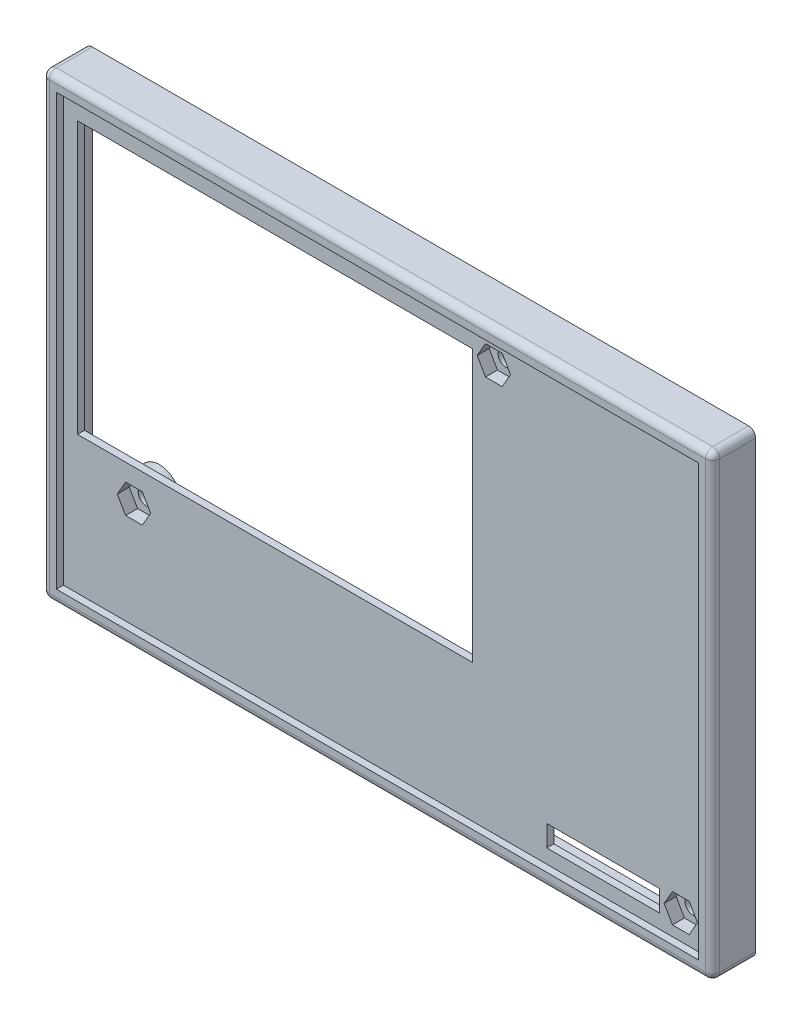
from build123d import *

# Parameters (mm, degrees)
EXTRUDE_346_DEPTH           = 5
EXTRUDE_346_DEPTH_BACK      = 1.1
SKETCH_2_W                  = 95
SKETCH_2_H                  = 65
SKETCH_3_W                  = 56
SKETCH_3_H                  = 38.5
CUT_EXTRUDE_448_DEPTH       = 5
CUT_EXTRUDE_527_DEPTH       = 3
CUT_EXTRUDE_527_DEPTH_BACK  = 1.1
SKETCH_4_W                  = 93
SKETCH_4_H                  = 63
CUT_EXTRUDE_START           = 5
SKETCH_5_W                  = 91
SKETCH_5_H                  = 61
CUT_EXTRUDE_612_DEPTH       = 1
CUT_EXTRUDE_START_2         = 4
SKETCH_6_W                  = 16
SKETCH_6_H                  = 3
CUT_EXTRUDE_697_DEPTH       = 1
WRAP_1_OUTLINE_R            = 3
WRAP_1_DEPTH                = 2.6
SKETCH_13_R                 = 1.1
CUT_EXTRUDE_1_DEPTH         = 116.221569161
SKETCH_15_R                 = 3
EXTRUDE_2_DEPTH             = 2.6
OTHER_START                 = 0.4
OTHER_2_OUTLINE_R           = 1.1
OTHER_2_DEPTH               = 3.6
SKETCH_16_R                 = 3
EXTRUDE_3_DEPTH             = 2.6
OTHER_3_OUTLINE_R           = 1.1
OTHER_3_DEPTH               = 3.6
EXTRUDE_1_DEPTH             = 4.1
EXTRUDE_2_2_DEPTH           = 4.1
EXTRUDE_3_2_DEPTH           = 4.1
EXTRUDE_4_DEPTH             = 4.1
CUT_EXTRUDE_3053_DEPTH      = 0.4
CUT_EXTRUDE_3053_DEPTH_BACK = 1.1
SKETCH_21_W                 = 91.4
SKETCH_21_H                 = 61.4
CUT_EXTRUDE_1_2_DEPTH       = 1.7
CUT_EXTRUDE_2_DEPTH         = 1.7
CUT_EXTRUDE_3_DEPTH         = 1.7
FILLET_1_R                  = 1
FILLET_2_R                  = 1
FILLET_3_R                  = 1
FILLET_4_R                  = 1


# Read off the part's stored shape, not the designer's step: Стойка1, Отверстие2, Отверстие3
with BuildPart() as part:
    # Эскиз2 → Extrude 346 (new, two sides: drawn at the far end of the back side and taken through both)
    with BuildSketch(Plane.XY.offset(-EXTRUDE_346_DEPTH_BACK)):
        with Locations((47.5, 32.5)):
            Rectangle(SKETCH_2_W, SKETCH_2_H)
    extrude(amount=EXTRUDE_346_DEPTH + EXTRUDE_346_DEPTH_BACK)

    # Эскиз3 → Cut-Extrude 448 (cut)
    with BuildSketch(Plane.XY):
        with Locations((32, 40.75)):
            Rectangle(SKETCH_3_W, SKETCH_3_H)
    extrude(amount=CUT_EXTRUDE_448_DEPTH, mode=Mode.SUBTRACT)

    # Эскиз4 → Cut-Extrude 527 (cut, two sides: drawn at the far end of the back side and taken through both)
    with BuildSketch(Plane.XY.offset(-CUT_EXTRUDE_527_DEPTH_BACK)):
        with Locations((47.5, 32.5)):
            Rectangle(SKETCH_4_W, SKETCH_4_H)
    extrude(amount=CUT_EXTRUDE_527_DEPTH + CUT_EXTRUDE_527_DEPTH_BACK, mode=Mode.SUBTRACT)

    # Эскиз5 → Cut-Extrude 612 (cut)
    with BuildSketch(Plane.XY.offset(CUT_EXTRUDE_START)):
        with Locations((47.5, 32.5)):
            Rectangle(SKETCH_5_W, SKETCH_5_H)
    extrude(amount=-CUT_EXTRUDE_612_DEPTH, mode=Mode.SUBTRACT)

    # Эскиз6 → Cut-Extrude 697 (cut)
    with BuildSketch(Plane.XY.offset(CUT_EXTRUDE_START_2)):
        with Locations((78.5, 5.5)):
            Rectangle(SKETCH_6_W, SKETCH_6_H)
    extrude(amount=-CUT_EXTRUDE_697_DEPTH, mode=Mode.SUBTRACT)

    # Стойка1 outline → Стойка1 (add)
    with BuildSketch(Plane(origin=(0, 0, 3), x_dir=(-1, 0, 0), z_dir=(0, 0, -1))):
        with Locations((-12, 17)):
            Circle(WRAP_1_OUTLINE_R)
    extrude(amount=WRAP_1_DEPTH)

    # Эскиз13 → Cut-Extrude 1 (cut, through all)
    with BuildSketch(Plane.XY.offset(4)):
        with Locations((12, 17)):
            Circle(SKETCH_13_R)
    extrude(amount=-CUT_EXTRUDE_1_DEPTH, mode=Mode.SUBTRACT)

    # Эскиз15 → Extrude 2 (add)
    with BuildSketch(Plane(origin=(0, 0, 3), x_dir=(-1, 0, 0), z_dir=(0, 0, -1))):
        with Locations((-63, 59.5)):
            Circle(SKETCH_15_R)
    extrude(amount=EXTRUDE_2_DEPTH)

    # Отверстие2 outline → Отверстие2 (cut)
    with BuildSketch(Plane.XY.offset(OTHER_START)):
        with Locations((63, 59.5)):
            Circle(OTHER_2_OUTLINE_R)
    extrude(amount=OTHER_2_DEPTH, mode=Mode.SUBTRACT)

    # Эскиз16 → Extrude 3 (add)
    with BuildSketch(Plane(origin=(0, 0, 3), x_dir=(-1, 0, 0), z_dir=(0, 0, -1))):
        with Locations((-89.5, 5.5)):
            Circle(SKETCH_16_R)
    extrude(amount=EXTRUDE_3_DEPTH)

    # Отверстие3 outline → Отверстие3 (cut)
    with BuildSketch(Plane.XY.offset(OTHER_START)):
        with Locations((89.5, 5.5)):
            Circle(OTHER_3_OUTLINE_R)
    extrude(amount=OTHER_3_DEPTH, mode=Mode.SUBTRACT)

    # Эскиз22 → Угол1 (add)
    with BuildSketch(Plane(origin=(0, 0, 3), x_dir=(-1, 0, 0), z_dir=(0, 0, -1))):
        Polygon((-1, 64), (-1, 60), (-5, 64), align=None)
    extrude(amount=EXTRUDE_1_DEPTH)

    # Эскиз20 → Extrude 2 2 (add)
    with BuildSketch(Plane(origin=(0, 0, 3), x_dir=(-1, 0, 0), z_dir=(0, 0, -1))):
        Polygon((-1, 1), (-1, 5), (-5, 1), align=None)
    extrude(amount=EXTRUDE_2_2_DEPTH)

    # Эскиз23 → Extrude 3 2 (add)
    with BuildSketch(Plane(origin=(0, 0, 3), x_dir=(-1, 0, 0), z_dir=(0, 0, -1))):
        Polygon((-94, 1), (-90, 1), (-94, 5), align=None)
    extrude(amount=EXTRUDE_3_2_DEPTH)

    # Эскиз24 → Угол4 (add)
    with BuildSketch(Plane(origin=(0, 0, 3), x_dir=(-1, 0, 0), z_dir=(0, 0, -1))):
        Polygon((-94, 64), (-90, 64), (-94, 60), align=None)
    extrude(amount=EXTRUDE_4_DEPTH)

    # Эскиз21 → Cut-Extrude 3053 (cut, two sides: drawn at the far end of the back side and taken through both)
    with BuildSketch(Plane.XY.offset(-CUT_EXTRUDE_3053_DEPTH_BACK)):
        with Locations((47.5, 32.5)):
            Rectangle(SKETCH_21_W, SKETCH_21_H)
    extrude(amount=CUT_EXTRUDE_3053_DEPTH + CUT_EXTRUDE_3053_DEPTH_BACK, mode=Mode.SUBTRACT)

    # Эскиз25 → Cut-Extrude 1 2 (cut)
    with BuildSketch(Plane.XY.offset(4)):
        Polygon((9.632863896, 17), (10.816431948, 14.95), (13.183568052, 14.95), (14.367136104, 17), (13.183568052, 19.05), (10.816431948, 19.05), align=None)
    extrude(amount=-CUT_EXTRUDE_1_2_DEPTH, mode=Mode.SUBTRACT)

    # Эскиз27 → Гайка2 (cut)
    with BuildSketch(Plane.XY.offset(4)):
        Polygon((65.367136104, 59.5), (64.183568052, 61.55), (61.816431948, 61.55), (60.632863896, 59.5), (61.816431948, 57.45), (64.183568052, 57.45), align=None)
    extrude(amount=-CUT_EXTRUDE_2_DEPTH, mode=Mode.SUBTRACT)

    # Эскиз28 → Гайка3 (cut)
    with BuildSketch(Plane.XY.offset(4)):
        Polygon((91.867136104, 5.5), (90.683568052, 7.55), (88.316431948, 7.55), (87.132863896, 5.5), (88.316431948, 3.45), (90.683568052, 3.45), align=None)
    extrude(amount=-CUT_EXTRUDE_3_DEPTH, mode=Mode.SUBTRACT)

    # Скругление1
    fillet_1_edges = [part.edges().sort_by_distance(p)[0] for p in [
        (47.5, 65, 5),
    ]]
    fillet(fillet_1_edges, radius=FILLET_1_R)

    # Скругление2
    fillet_2_edges = [part.edges().sort_by_distance(p)[0] for p in [
        (95, 32, 5),
        (95, 64.707106781, 4.707106781),
        (95, 65, 1.45),
    ]]
    fillet(fillet_2_edges, radius=FILLET_2_R)

    # Скругление3
    fillet_3_edges = [part.edges().sort_by_distance(p)[0] for p in [
        (47, 0, 5),
        (94.707106781, 0, 4.707106781),
        (95, 0, 1.45),
    ]]
    fillet(fillet_3_edges, radius=FILLET_3_R)

    # Скругление4
    fillet_4_edges = [part.edges().sort_by_distance(p)[0] for p in [
        (0, 32.5, 5),
        (0, 64.707106781, 4.707106781),
        (0, 0.292893219, 4.707106781),
        (0, 65, 1.45),
        (0, 0, 1.45),
    ]]
    fillet(fillet_4_edges, radius=FILLET_4_R)


solid = part.part
